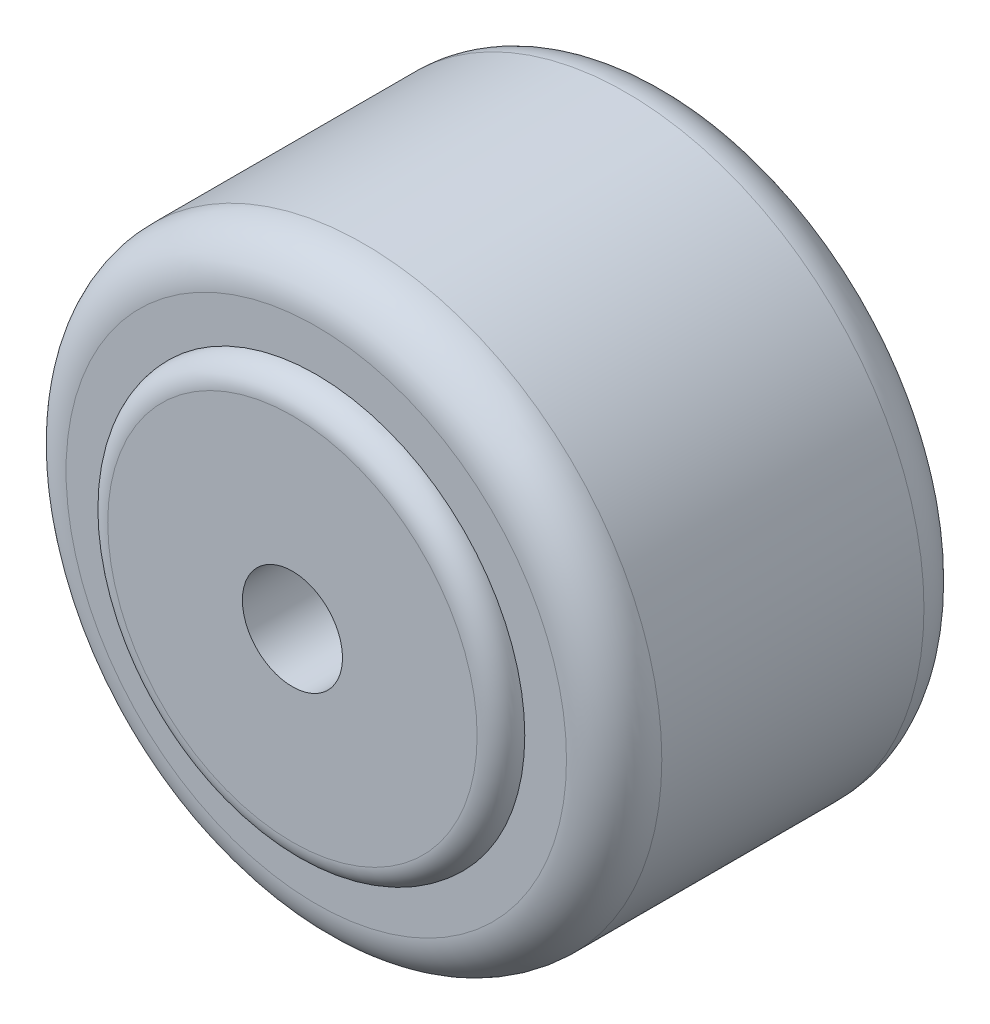
from build123d import *

# Parameters (mm, degrees)
SKETCH_1_R          = 25
EXTRUDE_1_DEPTH     = 30
FILLET_1_R          = 4
FILLET_2_R          = 4
SKETCH_2_R          = 17.5
EXTRUDE_2_DEPTH     = 2
FILLET_3_R          = 2
EXTRUDE_START       = 2
SKETCH_3_R          = 17.5
EXTRUDE_3_DEPTH     = 2
FILLET_4_R          = 2
SKETCH_4_R          = 4.2
CUT_EXTRUDE_1_DEPTH = 50.050993874


with BuildPart() as part:
    # 草图1 → 凸台-拉伸1 (new body)
    with BuildSketch(Plane.XY):
        Circle(SKETCH_1_R)
    extrude(amount=EXTRUDE_1_DEPTH)

    # 圆角1
    fillet_1_edges = [part.edges().sort_by_distance(p)[0] for p in [
        (-25, 0, 30),
    ]]
    fillet(fillet_1_edges, radius=FILLET_1_R)

    # 圆角2
    fillet_2_edges = [part.edges().sort_by_distance(p)[0] for p in [
        (-25, 0, 0),
    ]]
    fillet(fillet_2_edges, radius=FILLET_2_R)

    # 草图2 → 凸台-拉伸2 (add)
    with BuildSketch(Plane.XY.offset(30)):
        Circle(SKETCH_2_R)
    extrude(amount=EXTRUDE_2_DEPTH)

    # 圆角3
    fillet_3_edges = [part.edges().sort_by_distance(p)[0] for p in [
        (-17.5, 0, 32),
    ]]
    fillet(fillet_3_edges, radius=FILLET_3_R - 0.0001)  # a hair under: the kernel refuses the full size

    # 草图3 → 凸台-拉伸3 (add)
    with BuildSketch(Plane(origin=(0, 0, 0), x_dir=(-1, 0, 0), z_dir=(0, 0, -1)).offset(EXTRUDE_START)):
        with Locations(Location((0, 0, 0), (0, 0, 180))):
            Circle(SKETCH_3_R)
    extrude(amount=-EXTRUDE_3_DEPTH)

    # 圆角4
    fillet_4_edges = [part.edges().sort_by_distance(p)[0] for p in [
        (-17.5, 0, -2),
    ]]
    fillet(fillet_4_edges, radius=FILLET_4_R - 0.0001)  # a hair under: the kernel refuses the full size

    # 草图4 → 切除-拉伸1 (cut, through all)
    with BuildSketch(Plane(origin=(0, 0, -2), x_dir=(-1, 0, 0), z_dir=(0, 0, -1))):
        Circle(SKETCH_4_R)
    extrude(amount=-CUT_EXTRUDE_1_DEPTH, mode=Mode.SUBTRACT)


solid = part.part
